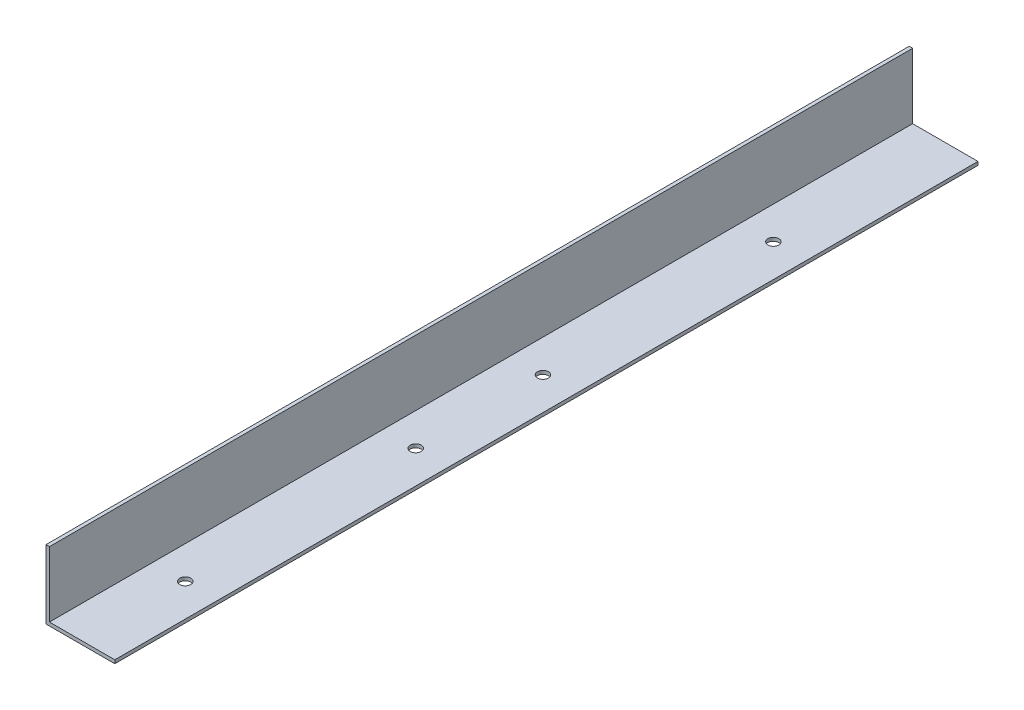
from build123d import *

# Parameters (mm, degrees)
EXTRUDE_1_DEPTH     = 251
SKETCH_2_R          = 1.6
CUT_EXTRUDE_1_DEPTH = 253.511385882


with BuildPart() as part:
    # Эскиз1 → Бобышка-Вытянуть1 (new body)
    with BuildSketch(Plane.XY):
        Polygon((0, 0), (0, 20), (1, 20), (1, 1), (20, 1), (20, 0), align=None)
    extrude(amount=EXTRUDE_1_DEPTH)

    # Эскиз2 → Вырез-Вытянуть1 (cut, through all)
    with BuildSketch(Plane(origin=(0, 1, 0), x_dir=(1, 0, 0), z_dir=(0, 1, 0))):
        with Locations((10.5, -50)):
            Circle(SKETCH_2_R)
        with Locations((10.5, -117)):
            Circle(SKETCH_2_R)
        with Locations((10.5, -221)):
            Circle(SKETCH_2_R)
        with Locations((10.5, -154)):
            Circle(SKETCH_2_R)
    extrude(amount=-CUT_EXTRUDE_1_DEPTH, mode=Mode.SUBTRACT)


solid = part.part
